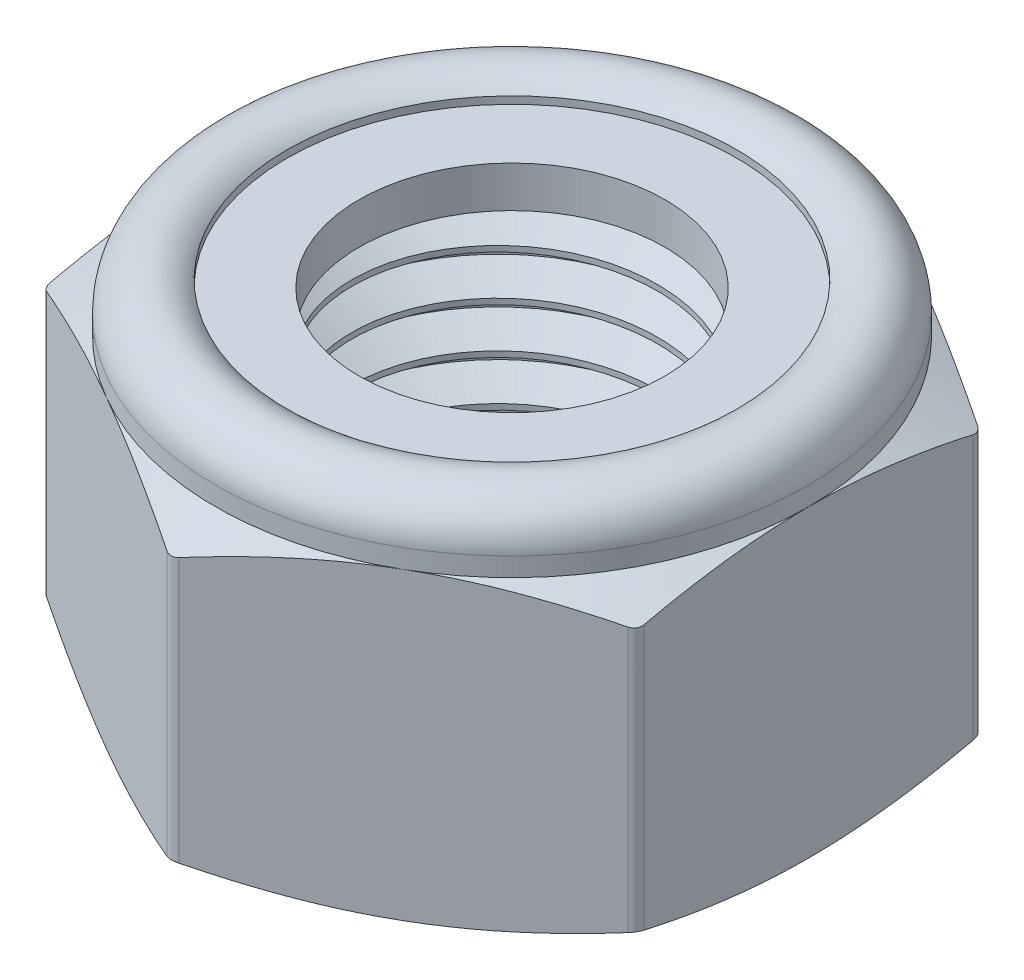
from build123d import *

# Parameters (mm, degrees)
BOSS_EXTRUDE1_DEPTH      = 4
BOSS_EXTRUDE1_DEPTH_BACK = 4
SKETCH2_R                = 3.350480947
FILLET1_R                = 0.26
SKETCH4_W                = 1.574759527
SKETCH4_H                = 0.903147313
SKETCH6_W                = 4
SKETCH6_H                = 6.666666667
CUT_SWEEP1_PITCH         = 1
SKETCH10_R               = 4.150480947
BOSS_EXTRUDE2_DEPTH      = 6.666666667


with BuildPart() as part:
    # Sketch2 → Boss-Extrude1 (new, two sides: drawn at the far end of the back side and taken through both)
    with BuildSketch(Plane(origin=(0, 0, 0), x_dir=(1, 0, 0), z_dir=(0, 1, 0)).offset(-BOSS_EXTRUDE1_DEPTH_BACK)):
        Polygon((0, 7.505553499), (-6.5, 3.75277675), (-6.5, -3.75277675), (0, -7.505553499), (6.5, -3.75277675), (6.5, 3.75277675), align=None)
        with Locations(Location((0, 0, 0), (0, 0, 270))):
            Circle(SKETCH2_R, mode=Mode.SUBTRACT)
    extrude(amount=BOSS_EXTRUDE1_DEPTH + BOSS_EXTRUDE1_DEPTH_BACK)

    # Fillet1
    fillet1_edges = [part.edges().sort_by_distance(p)[0] for p in [
        (6.5, 0, -3.75277675),
        (6.5, 0, 3.75277675),
        (0, 0, 7.505553499),
        (-6.5, 0, 3.75277675),
        (-6.5, 0, -3.75277675),
        (0, 0, -7.505553499),
    ]]
    fillet(fillet1_edges, radius=FILLET1_R)

    # Sketch3 → Cut-Revolve2 (revolve, cut)
    with BuildSketch(Plane(origin=(0, 0, 0), x_dir=(0, 0, -1), z_dir=(1, 0, 0)), mode=Mode.PRIVATE) as cut_revolve2_sk:
        with BuildLine():
            Line((7.505553499, 2.666666667), (7.505553499, 5))
            Line((7.505553499, 5), (3.350480947, 5))
            Line((3.350480947, 5), (3.350480947, 2.666666667))
            Line((3.350480947, 2.666666667), (4.925240474, 2.666666667))
            Line((4.925240474, 2.666666667), (4.925240474, 3.72981398))
            ThreePointArc((4.925240474, 3.72981398), (5.930542274, 3.929780941), (6.5, 3.077527227))
            Line((6.5, 3.077527227), (6.5, 2.666666667))
            Line((6.5, 2.666666667), (7.505553499, 2.197769369))
            Line((7.505553499, 2.197769369), (7.505553499, 2.666666667))
        make_face()
        Polygon((6.5, -4), (7.505553499, -3.531102703), (7.505553499, -4), align=None)
        Polygon((3.350480947, -4), (3.350480947, -3.2), (4.150480947, -4), align=None)
    revolve(cut_revolve2_sk.sketch.rotate(Axis((0, -4, 0), (0, 1, 0)), 270), axis=Axis((0, -4, 0), (0, 1, 0)), mode=Mode.SUBTRACT)

    # Sketch10 → Boss-Extrude2 (add)
    with BuildSketch(Plane.XZ.offset(4)):
        Circle(SKETCH10_R)
    extrude(amount=-BOSS_EXTRUDE2_DEPTH)


with BuildPart() as body_2:
    # Sketch4 → Revolve1 (revolve)
    with BuildSketch(Plane(origin=(0, 0, 0), x_dir=(0, 0, -1), z_dir=(1, 0, 0)), mode=Mode.PRIVATE) as revolve1_sk:
        with Locations((-4.137860711, 3.118240324)):
            Rectangle(SKETCH4_W, SKETCH4_H)
    revolve(revolve1_sk.sketch.rotate(Axis((0, -4, 0), (0, 1, 0)), 90), axis=Axis((0, -4, 0), (0, 1, 0)))


with BuildPart() as body_3:
    # Sketch6 → Revolve2 (revolve)
    with BuildSketch(Plane.XY, mode=Mode.PRIVATE) as revolve2_sk:
        with Locations((2, -0.666666666)):
            Rectangle(SKETCH6_W, SKETCH6_H)
    revolve(revolve2_sk.sketch.rotate(Axis((0, -4, 0), (0, 1, 0)), 90), axis=Axis((0, -4, 0), (0, 1, 0)))

    # Cut-Sweep1: the profile of Sketch8 profile screwed along a right-hand helix of 8 turns, 8 arcs to a turn; built about Z, then put on its axis
    cut_sweep1_z = Axis((0, 0, 0), (0, 0, 1))
    cut_sweep1_corners = [(3.350180947, 0, -0.375173205), (3.350180947, 0, -0.499826795), (4.054126588, 0, -0.90625), (4.108253175, 0, 0.0625)]
    with BuildLine(mode=Mode.PRIVATE) as cut_sweep1_profile:
        Line(cut_sweep1_corners[0], cut_sweep1_corners[1])
        Line(cut_sweep1_corners[1], cut_sweep1_corners[2])
        Line(cut_sweep1_corners[2], cut_sweep1_corners[3])
        Line(cut_sweep1_corners[3], cut_sweep1_corners[0])
    cut_sweep1_cap = Face(cut_sweep1_profile.wire())
    cut_sweep1_turn_angles = [0, 22.5, 45, 67.5, 90, 112.5, 135, 157.5, 180, 202.5, 225, 247.5, 270, 292.5, 315, 337.5, 360]
    cut_sweep1_turn_weights = [1, 0.9238795325112867, 1, 0.9238795325112867, 1, 0.9238795325112867, 1, 0.9238795325112867, 1, 0.9238795325112867, 1, 0.9238795325112867, 1, 0.9238795325112867, 1, 0.9238795325112867, 1]
    cut_sweep1_turn_rails = [Edge.make_bspline([Vector(p[0], p[1], 0).rotate(cut_sweep1_z, cut_sweep1_turn_angles[k]) / cut_sweep1_turn_weights[k] + Vector(0, 0, p[2] + CUT_SWEEP1_PITCH * cut_sweep1_turn_angles[k] / 360) for k in range(17)], [0, 0, 0, 1, 1, 2, 2, 3, 3, 4, 4, 5, 5, 6, 6, 7, 7, 8, 8, 8], 2, cut_sweep1_turn_weights) for p in cut_sweep1_corners]
    cut_sweep1_turn_sides = [Face.make_surface_from_curves(cut_sweep1_turn_rails[p[0]], cut_sweep1_turn_rails[p[1]]) for p in [(0, 1), (1, 2), (2, 3), (3, 0)]]
    cut_sweep1 = Plane(origin=(0, -4, 0), x_dir=(1, 0, 0), z_dir=(0, 1, 0)) * Solid(Shell([*[p.moved(Location((0, 0, CUT_SWEEP1_PITCH * i))) for i in range(8) for p in cut_sweep1_turn_sides], cut_sweep1_cap, cut_sweep1_cap.rotate(cut_sweep1_z, 2880).moved(Location((0, 0, CUT_SWEEP1_PITCH * 2880 / 360)))]))
    add(cut_sweep1, mode=Mode.SUBTRACT)

    # Sketch9 → Revolve3 (revolve)
    with BuildSketch(Plane.XY, mode=Mode.PRIVATE) as revolve3_sk:
        Polygon((0, 0), (0, -4), (4, -4), (4.8, -4), (0, 0.8), align=None)
    revolve(revolve3_sk.sketch.rotate(Axis((0, 0, 0), (0, -1, 0)), 18.279680729), axis=Axis((0, 0, 0), (0, -1, 0)))


with BuildPart() as part_1:
    add(part.part)

    # Combine1: cut body 3
    add(body_3.part, mode=Mode.SUBTRACT)


solid = Compound([body_2.part, part_1.part])
